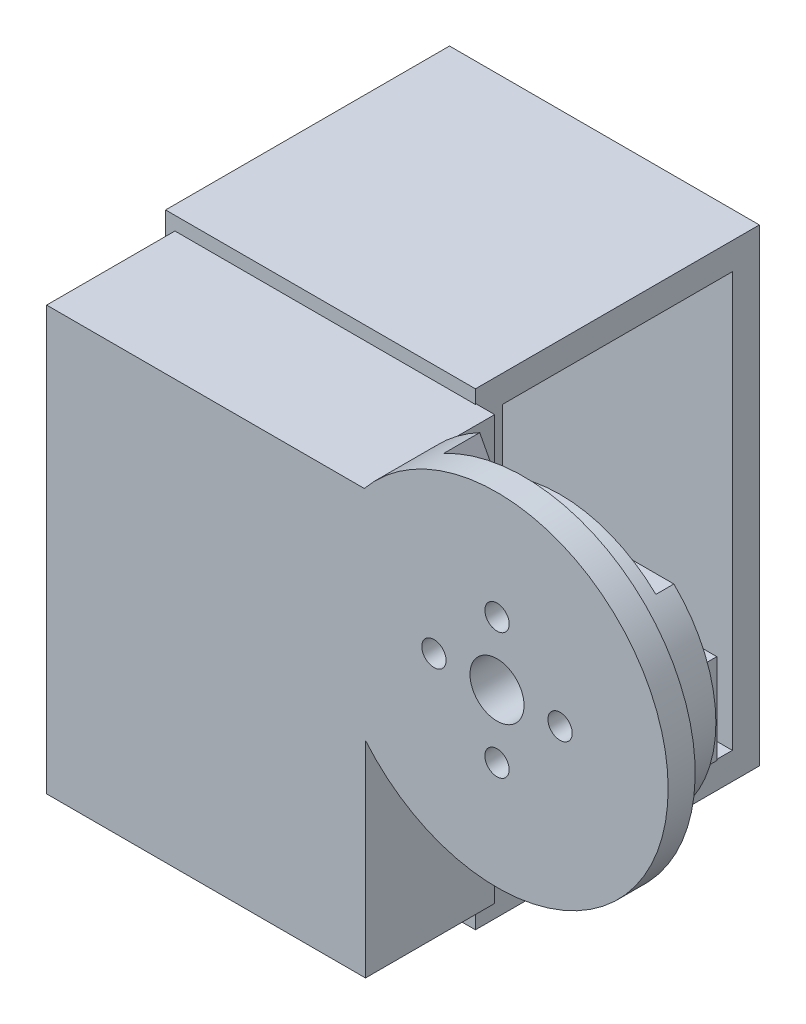
from build123d import *

# Parameters (mm, degrees)
S_CYL1_R      = 19
BOSS_1_DEPTH  = 7
BOSS_2_DEPTH  = 2.1
S_BOX3_W      = 28.2
S_BOX3_H      = 10
BOSS_3_DEPTH  = 1.5
S_BOX4_W      = 35.4
S_BOX4_H      = 47
BOSS_4_DEPTH  = 14.34
S_BOX5_W      = 34.4
S_BOX5_H      = 3
BOSS_5_DEPTH  = 31.52
S_BOX6_W      = 34.4
S_BOX6_H      = 3
BOSS_6_DEPTH  = 31.52
S_BOX7_W      = 34.4
S_BOX7_H      = 52.02
BOSS_7_DEPTH  = 3
S_BOX8_W      = 34.4
S_BOX8_H      = 52.02
BOSS_8_DEPTH  = 3
S_BOX9_W      = 2.4
S_BOX9_H      = 52.02
BOSS_9_DEPTH  = 31.52
S_HOLE10_R    = 11
HOLE_10_DEPTH = 2.6
S_HOLE11_R    = 1.1
HOLE_11_DEPTH = 2.6
S_HOLE12_R    = 1.1
HOLE_12_DEPTH = 2.6
S_HOLE13_R    = 1.1
HOLE_13_DEPTH = 2.6
CUT_14_DEPTH  = 6.1
S_HOLE15_R    = 3
HOLE_15_DEPTH = 10.6
S_HOLE16_R    = 1.35
HOLE_16_DEPTH = 10.6
S_HOLE17_R    = 1.35
HOLE_17_DEPTH = 10.6
S_HOLE18_R    = 1.35
HOLE_18_DEPTH = 10.6
S_HOLE19_R    = 1.35
HOLE_19_DEPTH = 10.6
S_HOLE20_R    = 2.3
HOLE_20_DEPTH = 4.5
S_HOLE21_R    = 2.3
HOLE_21_DEPTH = 4.5
S_HOLE22_R    = 2.3
HOLE_22_DEPTH = 4.5
S_HOLE23_R    = 2.3
HOLE_23_DEPTH = 4.5


with BuildPart() as part:
    # S_cyl1 → Boss_1 (new body)
    with BuildSketch(Plane.XY.offset(23)):
        Circle(S_CYL1_R)
    extrude(amount=BOSS_1_DEPTH)

    # S_prism2 → Boss_2 (add)
    with BuildSketch(Plane.XY.offset(21)):
        with BuildLine():
            Line((-15.491933385, -11), (15.491933385, -11))
            ThreePointArc((15.491933385, -11), (19, 0), (15.491933385, 11))
            Line((15.491933385, 11), (-15.491933385, 11))
            ThreePointArc((-15.491933385, 11), (-19, 0), (-15.491933385, -11))
        make_face()
    extrude(amount=BOSS_2_DEPTH)

    # S_box3 → Boss_3 (add)
    with BuildSketch(Plane.XY.offset(19.6)):
        with Locations((-0.1, 0)):
            Rectangle(S_BOX3_W, S_BOX3_H)
    extrude(amount=BOSS_3_DEPTH)

    # S_box4 → Boss_4 (add)
    with BuildSketch(Plane.XY.offset(15.66)):
        with Locations((-32.3, -11.5)):
            Rectangle(S_BOX4_W, S_BOX4_H)
    extrude(amount=BOSS_4_DEPTH)

    # S_box6 → Boss_6 (add)
    with BuildSketch(Plane.XY.offset(-15.76)):
        with Locations((-33.835, 12.01)):
            Rectangle(S_BOX6_W, S_BOX6_H)
    extrude(amount=BOSS_6_DEPTH)



with BuildPart() as body_2:
    # S_box5 → Boss_5 (new body)
    with BuildSketch(Plane.XY.offset(-15.76)):
        with Locations((-33.835, -37.01)):
            Rectangle(S_BOX5_W, S_BOX5_H)
    extrude(amount=BOSS_5_DEPTH)


with BuildPart() as part_1:
    add(part.part)

    add(body_2.part)  # Boss_7 merges body 2
    # S_box7 → Boss_7 (add)
    with BuildSketch(Plane.XY.offset(-15.76)):
        with Locations((-33.835, -12.5)):
            Rectangle(S_BOX7_W, S_BOX7_H)
    extrude(amount=BOSS_7_DEPTH)

    # S_box8 → Boss_8 (add)
    with BuildSketch(Plane.XY.offset(12.76)):
        with Locations((-33.835, -12.5)):
            Rectangle(S_BOX8_W, S_BOX8_H)
    extrude(amount=BOSS_8_DEPTH)

    # S_box9 → Boss_9 (add)
    with BuildSketch(Plane.XY.offset(-15.76)):
        with Locations((-49.835, -12.5)):
            Rectangle(S_BOX9_W, S_BOX9_H)
    extrude(amount=BOSS_9_DEPTH)

    # S_hole10 → Hole_10 (cut)
    with BuildSketch(Plane(origin=(-51.135, 0, 0), x_dir=(0, 0, -1), z_dir=(1, 0, 0))):
        Circle(S_HOLE10_R)
    extrude(amount=HOLE_10_DEPTH, mode=Mode.SUBTRACT)

    # S_hole11 → Hole_11 (cut)
    with BuildSketch(Plane(origin=(-51.135, 0, 0), x_dir=(0, 0, -1), z_dir=(1, 0, 0))):
        with Locations((-10.25, -8.3)):
            Circle(S_HOLE11_R)
    extrude(amount=HOLE_11_DEPTH, mode=Mode.SUBTRACT)

    # S_hole12 → Hole_12 (cut)
    with BuildSketch(Plane(origin=(-51.135, 0, 0), x_dir=(0, 0, -1), z_dir=(1, 0, 0))):
        with Locations((10.25, -32.75)):
            Circle(S_HOLE12_R)
    extrude(amount=HOLE_12_DEPTH, mode=Mode.SUBTRACT)

    # S_hole13 → Hole_13 (cut)
    with BuildSketch(Plane(origin=(-51.135, 0, 0), x_dir=(0, 0, -1), z_dir=(1, 0, 0))):
        with Locations((-10.25, -32.75)):
            Circle(S_HOLE13_R)
    extrude(amount=HOLE_13_DEPTH, mode=Mode.SUBTRACT)

    # S_pcut14 → Cut_14 (cut)
    with BuildSketch(Plane.XY.offset(20.9)):
        with BuildLine():
            Line((-9.201642631, 17.30577282), (-7.182914911, 13.509098171))
            ThreePointArc((-7.182914911, 13.509098171), (13.316442148, 7.53408047), (7.880082546, -13.114659701))
            Line((7.880082546, -13.114659701), (10.094746268, -16.800479094))
            ThreePointArc((10.094746268, -16.800479094), (17.05897164, 9.651501778), (-9.201642631, 17.30577282))
        make_face()
    extrude(amount=CUT_14_DEPTH, mode=Mode.SUBTRACT)

    # S_hole15 → Hole_15 (cut)
    with BuildSketch(Plane.XY.offset(19.5)):
        Circle(S_HOLE15_R)
    extrude(amount=HOLE_15_DEPTH, mode=Mode.SUBTRACT)

    # S_hole16 → Hole_16 (cut)
    with BuildSketch(Plane.XY.offset(19.5)):
        with Locations((7, 0)):
            Circle(S_HOLE16_R)
    extrude(amount=HOLE_16_DEPTH, mode=Mode.SUBTRACT)

    # S_hole17 → Hole_17 (cut)
    with BuildSketch(Plane.XY.offset(19.5)):
        with Locations((0, 7)):
            Circle(S_HOLE17_R)
    extrude(amount=HOLE_17_DEPTH, mode=Mode.SUBTRACT)

    # S_hole18 → Hole_18 (cut)
    with BuildSketch(Plane.XY.offset(19.5)):
        with Locations((-7, 0)):
            Circle(S_HOLE18_R)
    extrude(amount=HOLE_18_DEPTH, mode=Mode.SUBTRACT)

    # S_hole19 → Hole_19 (cut)
    with BuildSketch(Plane.XY.offset(19.5)):
        with Locations((0, -7)):
            Circle(S_HOLE19_R)
    extrude(amount=HOLE_19_DEPTH, mode=Mode.SUBTRACT)

    # S_hole20 → Hole_20 (cut)
    with BuildSketch(Plane.XY.offset(19.5)):
        with Locations((7, 0)):
            Circle(S_HOLE20_R)
    extrude(amount=HOLE_20_DEPTH, mode=Mode.SUBTRACT)

    # S_hole21 → Hole_21 (cut)
    with BuildSketch(Plane.XY.offset(19.5)):
        with Locations((0, 7)):
            Circle(S_HOLE21_R)
    extrude(amount=HOLE_21_DEPTH, mode=Mode.SUBTRACT)

    # S_hole22 → Hole_22 (cut)
    with BuildSketch(Plane.XY.offset(19.5)):
        with Locations((-7, 0)):
            Circle(S_HOLE22_R)
    extrude(amount=HOLE_22_DEPTH, mode=Mode.SUBTRACT)

    # S_hole23 → Hole_23 (cut)
    with BuildSketch(Plane.XY.offset(19.5)):
        with Locations((0, -7)):
            Circle(S_HOLE23_R)
    extrude(amount=HOLE_23_DEPTH, mode=Mode.SUBTRACT)


solid = part_1.part
